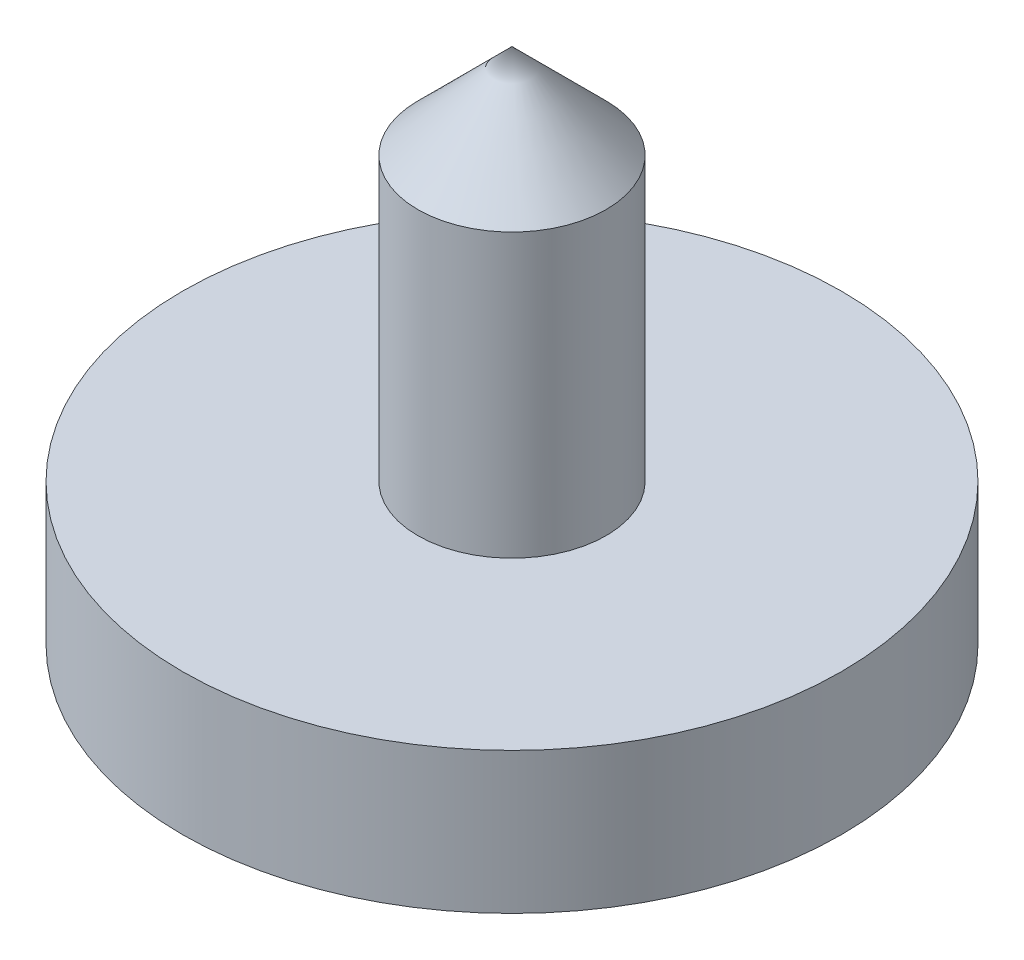
from build123d import *

# Parameters (mm, degrees)
BOSS_EXTRUDE1_START = 0.5
SKETCH1_R           = 3.5
BOSS_EXTRUDE1_DEPTH = 1.5
SKETCH5_R           = 1
BOSS_EXTRUDE2_DEPTH = 4
CHAMFER1_SIZE       = 1


# Read off the part's stored shape, not the designer's step: Cut-Loft1
with BuildPart() as part:
    # Sketch1 → Boss-Extrude1 (new body)
    with BuildSketch(Plane(origin=(0, 0, 0), x_dir=(1, 0, 0), z_dir=(0, 1, 0)).offset(BOSS_EXTRUDE1_START)):
        with Locations(Location((0, 0, 0), (0, 0, 270))):
            Circle(SKETCH1_R)
    extrude(amount=-BOSS_EXTRUDE1_DEPTH)

    # Cut-Loft1 outline → Cut-Loft1 (revolve, cut)
    with BuildSketch(Plane.XY):
        Polygon((3.5, -1), (0, 0), (0, -1), align=None)
    revolve(axis=Axis((0, 0, 0), (0, 1, 0)), mode=Mode.SUBTRACT)

    # Sketch5 → Boss-Extrude2 (add)
    with BuildSketch(Plane(origin=(0, 0.5, 0), x_dir=(1, 0, 0), z_dir=(0, 1, 0))):
        with Locations(Location((0, 0, 0), (0, 0, 270))):
            Circle(SKETCH5_R)
    extrude(amount=BOSS_EXTRUDE2_DEPTH)

    # Chamfer1
    chamfer1_edges = [part.edges().sort_by_distance(p)[0] for p in [
        (0, 4.5, -1),
    ]]
    chamfer(chamfer1_edges, length=CHAMFER1_SIZE)


solid = part.part
